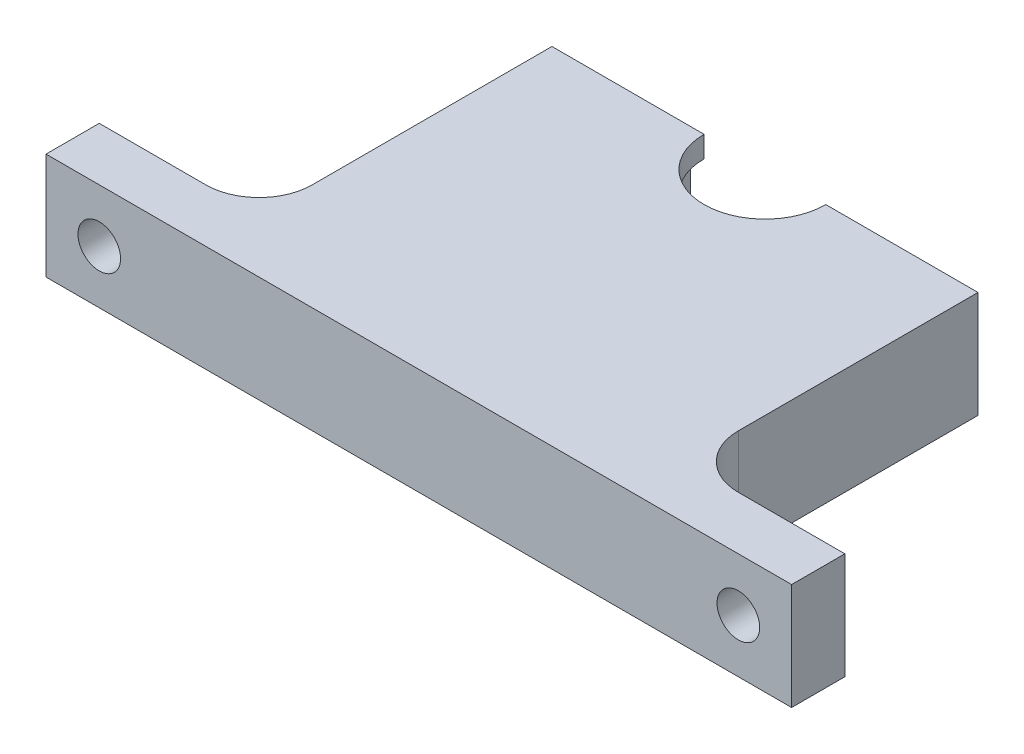
from build123d import *

# Parameters (mm, degrees)
BOSS_EXTRUDE1_DEPTH   = 5
SKETCH3_R             = 6.985
BEARING_CUTOUT_DEPTH  = 3
SKETCH4_R             = 1.5
TOP_MOUNT_HOLES_DEPTH = 10
SKETCH6_W             = 15
SKETCH6_H             = 10
SKETCH6_R             = 2
MOUNTING_HOLES_DEPTH  = 5
FILLET1_R             = 5


with BuildPart() as part:
    # Sketch1 → Boss-Extrude1 (new, symmetric)
    with BuildSketch(Plane(origin=(0, 0, 0), x_dir=(1, 0, 0), z_dir=(0, 1, 0))):
        with BuildLine():
            Line((20, 0), (12.7, 0))
            Line((12.7, 0), (5.715, 0))
            ThreePointArc((5.715, 0), (0, -5.715), (-5.715, 0))
            Line((-5.715, 0), (-12.7, 0))
            Line((-12.7, 0), (-20, 0))
            Line((-20, 0), (-20, -32.5))
            Line((-20, -32.5), (20, -32.5))
            Line((20, -32.5), (20, 0))
        make_face()
    extrude(amount=BOSS_EXTRUDE1_DEPTH, both=True)

    # Sketch3 → bearing cutout (cut, symmetric)
    with BuildSketch(Plane(origin=(0, 0, 0), x_dir=(1, 0, 0), z_dir=(0, 1, 0))):
        Circle(SKETCH3_R)
    extrude(amount=BEARING_CUTOUT_DEPTH, both=True, mode=Mode.SUBTRACT)

    # Sketch4 → top mount holes (cut)
    with BuildSketch(Plane(origin=(0, 0, 0), x_dir=(-1, 0, 0), z_dir=(0, 0, -1))):
        with Locations((-15, 0)):
            Circle(SKETCH4_R)
        with Locations((15, 0)):
            Circle(SKETCH4_R)
    extrude(amount=-TOP_MOUNT_HOLES_DEPTH, mode=Mode.SUBTRACT)

    # Sketch6 → mounting holes (add)
    # profile 1 of 2: a face of its own
    with BuildSketch(Plane.XY.offset(32.5)):
        with Locations((-27.5, 0)):
            Rectangle(SKETCH6_W, SKETCH6_H)
        with Locations((-30, 0)):
            Circle(SKETCH6_R, mode=Mode.SUBTRACT)
    # profile 2 of 2: a face of its own
    with BuildSketch(Plane.XY.offset(32.5)):
        with Locations((27.5, 0)):
            Rectangle(SKETCH6_W, SKETCH6_H)
        with Locations((30, 0)):
            Circle(SKETCH6_R, mode=Mode.SUBTRACT)
    extrude(amount=-MOUNTING_HOLES_DEPTH)

    # Fillet1
    fillet1_edges = [part.edges().sort_by_distance(p)[0] for p in [
        (20, 0, 27.5),
        (-20, 0, 27.5),
    ]]
    fillet(fillet1_edges, radius=FILLET1_R)


solid = part.part
